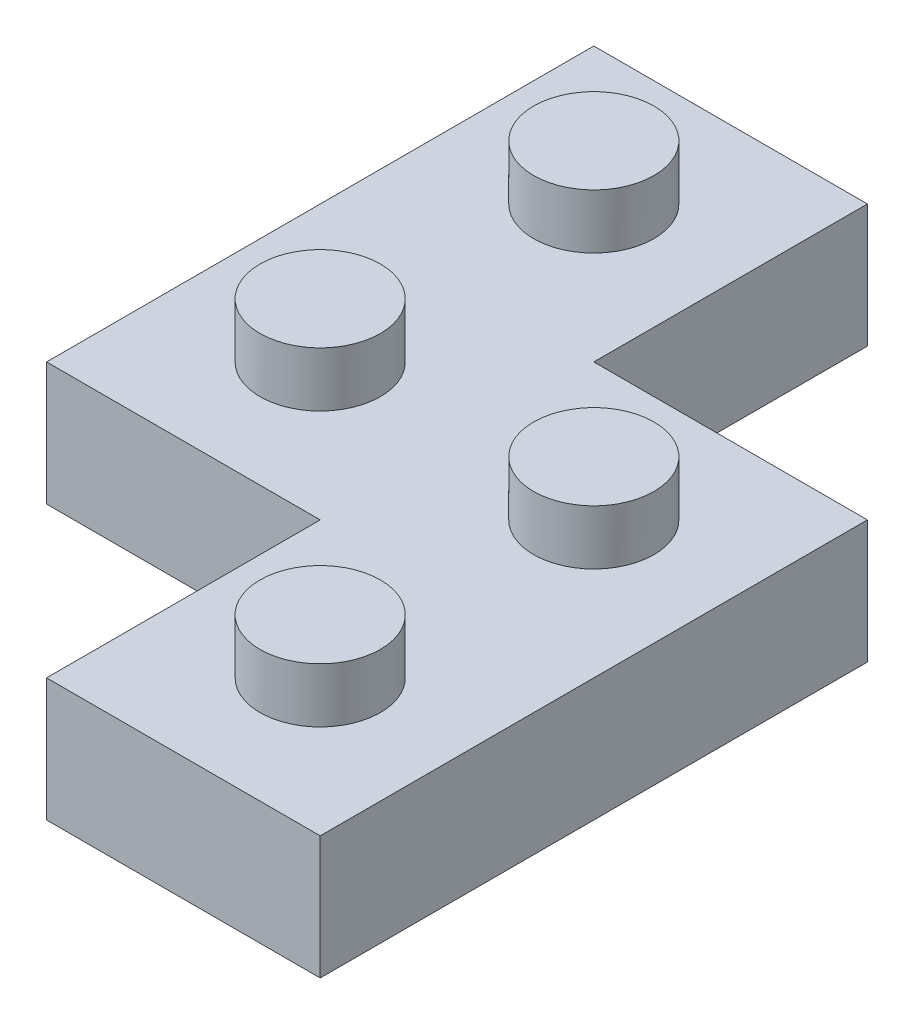
from build123d import *

# Parameters (mm, degrees)
BOSS_EXTRUDE1_DEPTH = 5.715
SKETCH2_R           = 2.794
BOSS_EXTRUDE3_DEPTH = 2.54


with BuildPart() as part:
    # Sketch1 → Boss-Extrude1 (new body)
    with BuildSketch(Plane(origin=(0, 0, 0), x_dir=(1, 0, 0), z_dir=(0, 1, 0))):
        Polygon((-5.674598366, 20.311212687), (7.025401634, 20.311212687), (7.025401634, 7.611212687), (19.725401634, 7.611212687), (19.725401634, -17.788787313), (7.025401634, -17.788787313), (7.025401634, -5.088787313), (-5.674598366, -5.088787313), align=None)
    extrude(amount=BOSS_EXTRUDE1_DEPTH)

    # Sketch2 → Boss-Extrude3 (add)
    with BuildSketch(Plane(origin=(0, 5.715, 0), x_dir=(1, 0, 0), z_dir=(0, 1, 0))):
        with Locations((0.675401634, 1.261212687)):
            Circle(SKETCH2_R)
        with Locations((13.375401634, 1.261212687)):
            Circle(SKETCH2_R)
        with Locations((0.675401634, 13.961212687)):
            Circle(SKETCH2_R)
        with Locations((13.375401634, -11.438787313)):
            Circle(SKETCH2_R)
    extrude(amount=BOSS_EXTRUDE3_DEPTH)


solid = part.part
